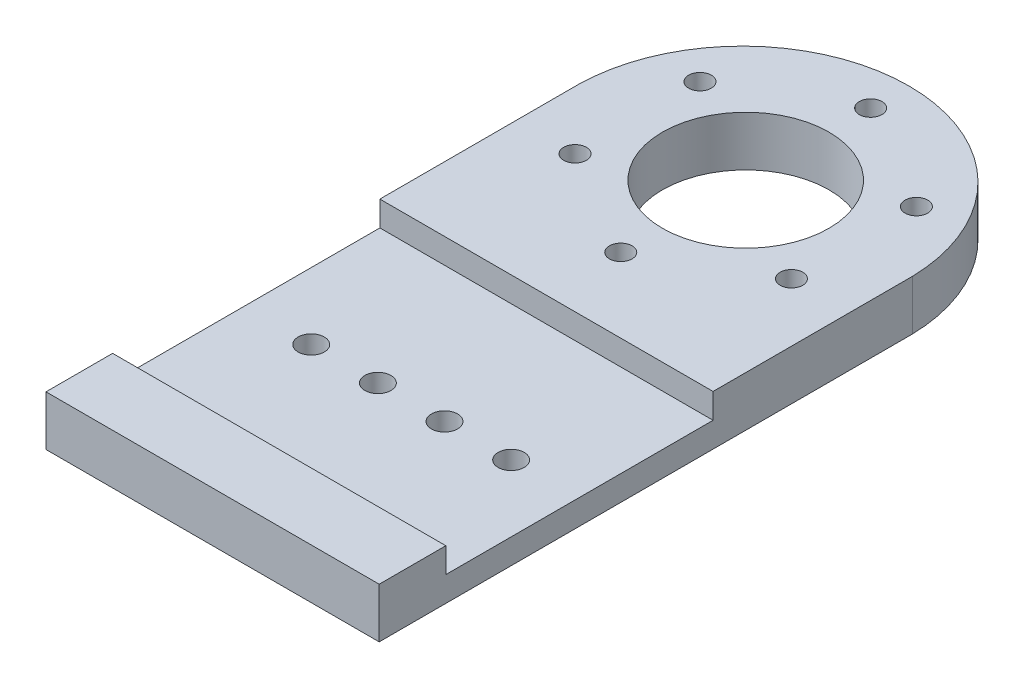
from build123d import *

# Parameters (mm, degrees)
SKETCH1_W             = 63.5
SKETCH1_H             = 12.7
BOSS_EXTRUDE2_DEPTH   = 9.525
SKETCH1_R             = 15.875
BOSS_EXTRUDE2_2_DEPTH = 9.525
SKETCH1_3_W           = 63.5
SKETCH1_3_H           = 50.927
SKETCH1_3_R           = 2.4892
BOSS_EXTRUDE3_DEPTH   = 4.7625
SKETCH2_R             = 2.159
CUT_EXTRUDE1_DEPTH    = 140.646776131


with BuildPart() as part:
    # Sketch1 → Boss-Extrude2 (new body)
    with BuildSketch(Plane(origin=(0, 0, 0), x_dir=(1, 0, 0), z_dir=(0, 1, 0))):
        with Locations((31.75, -117.659057971)):
            Rectangle(SKETCH1_W, SKETCH1_H)
    extrude(amount=BOSS_EXTRUDE2_DEPTH)



with BuildPart() as body_2:
    # Sketch1 → Boss-Extrude2 2 (new body)
    with BuildSketch(Plane(origin=(0, 0, 0), x_dir=(1, 0, 0), z_dir=(0, 1, 0))):
        with BuildLine():
            Line((0, -22.409057971), (0, -60.382057971))
            Line((0, -60.382057971), (63.5, -60.382057971))
            Line((63.5, -60.382057971), (63.5, -22.409057971))
            ThreePointArc((63.5, -22.409057971), (31.75, 8.708162444), (0, -22.409057971))
        make_face()
        with Locations((31.75, -22.409057971)):
            Circle(SKETCH1_R, mode=Mode.SUBTRACT)
    extrude(amount=BOSS_EXTRUDE2_2_DEPTH)


with BuildPart() as part_1:
    add(part.part)

    add(body_2.part)  # Boss-Extrude3 merges body 2
    # Sketch1<3> → Boss-Extrude3 (add)
    with BuildSketch(Plane(origin=(0, 0, 0), x_dir=(1, 0, 0), z_dir=(0, 1, 0))):
        with Locations((31.75, -85.845557971)):
            Rectangle(SKETCH1_3_W, SKETCH1_3_H)
        with Locations((12.7, -86.163057971)):
            Circle(SKETCH1_3_R, mode=Mode.SUBTRACT)
        with Locations((25.4, -86.163057971)):
            Circle(SKETCH1_3_R, mode=Mode.SUBTRACT)
        with Locations((38.1, -86.163057971)):
            Circle(SKETCH1_3_R, mode=Mode.SUBTRACT)
        with Locations((50.8, -86.163057971)):
            Circle(SKETCH1_3_R, mode=Mode.SUBTRACT)
    extrude(amount=BOSS_EXTRUDE3_DEPTH)

    # Sketch2 → Cut-Extrude1 (cut, through all)
    with BuildSketch(Plane.XZ):
        with Locations((11.127770072, 34.315307971)):
            Circle(SKETCH2_R)
        with Locations((31.75, 46.221557971)):
            Circle(SKETCH2_R)
        with Locations((52.372229928, 34.315307971)):
            Circle(SKETCH2_R)
        with Locations((52.372229928, 10.502807971)):
            Circle(SKETCH2_R)
        with Locations((31.75, -1.403442029)):
            Circle(SKETCH2_R)
        with Locations((11.127770072, 10.502807971)):
            Circle(SKETCH2_R)
    extrude(amount=-CUT_EXTRUDE1_DEPTH, mode=Mode.SUBTRACT)


solid = part_1.part
